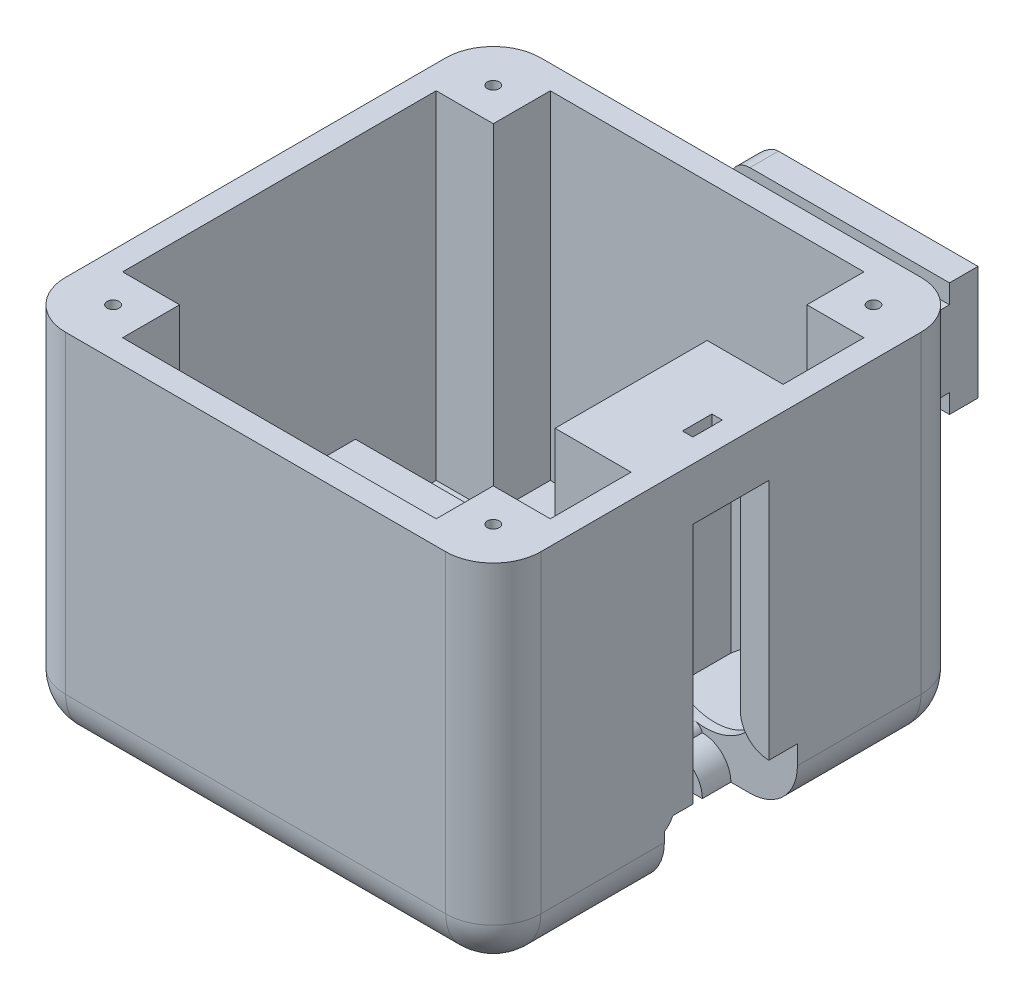
from build123d import *

# Parameters (mm, degrees)
SKETCH1_W                = 50
SKETCH1_H                = 50
BOSS_EXTRUDE1_DEPTH      = 38
SHELL1_T                 = -2.5
SKETCH3_W                = 45
SKETCH3_H                = 16
BOSS_EXTRUDE3_DEPTH      = 8
SKETCH4_W                = 32.5
SKETCH4_H                = 8
CUT_EXTRUDE1_DEPTH       = 3
SKETCH7_W                = 32.5
SKETCH7_H                = 12
CUT_EXTRUDE2_DEPTH       = 3
SKETCH8_W                = 16
SKETCH8_H                = 27.5
BOSS_EXTRUDE4_DEPTH      = 8
SKETCH9_W                = 8
SKETCH9_H                = 32.5
CUT_EXTRUDE3_DEPTH       = 3
CUT_EXTRUDE5_DEPTH       = 3
CUT_EXTRUDE7_DEPTH       = 10
CUT_EXTRUDE7_DEPTH_BACK  = 2
SKETCH13_W               = 3
SKETCH13_H               = 3.011524732
FILLET1_R                = 5
SKETCH16_R               = 2.3
CUT_EXTRUDE8_DEPTH       = 53.642663306
SKETCH17_W               = 23
SKETCH17_H               = 12
BOSS_EXTRUDE5_DEPTH      = 6
SKETCH18_W               = 3
SKETCH18_H               = 2
CUT_EXTRUDE9_DEPTH       = 57.471231614
CUT_EXTRUDE12_DEPTH      = 2
CUT_EXTRUDE13_DEPTH      = 2
CUT_EXTRUDE14_DEPTH      = 16
CUT_EXTRUDE10_START      = -19.5
CUT_EXTRUDE10_DEPTH      = 19.5
FILLET4_R                = 2
CUT_EXTRUDE18_DEPTH      = 13
CUT_EXTRUDE18_DEPTH_BACK = 1
SKETCH26_W               = 6
SKETCH26_H               = 6
BOSS_EXTRUDE6_DEPTH      = 4.5
SKETCH30_W               = 4.34
SKETCH30_H               = 1.8
CUT_EXTRUDE19_DEPTH      = 4.4
SKETCH31_W               = 1.8
SKETCH31_H               = 4.34
CUT_EXTRUDE20_DEPTH      = 4.4
SKETCH32_W               = 1.1
SKETCH32_H               = 3.1
CUT_EXTRUDE21_DEPTH      = 55.291896265
SKETCH33_W               = 3.1
SKETCH33_H               = 1.1
CUT_EXTRUDE22_DEPTH      = 3.55
SKETCH34_W               = 1.1
SKETCH34_H               = 3.1
CUT_EXTRUDE23_DEPTH      = 7.3
CUT_EXTRUDE26_DEPTH      = 2
SKETCH45_R               = 3.575
CUT_EXTRUDE27_DEPTH      = 20
FILLET8_R                = 2
SKETCH46_W               = 1.850257739
SKETCH46_H               = 4
SKETCH46_W_2             = 4
SKETCH46_H_2             = 1.850257739
CUT_EXTRUDE28_DEPTH      = 1
CUT_EXTRUDE25_START      = -3
CUT_EXTRUDE25_DEPTH      = 3
CUT_EXTRUDE24_START      = -3
CUT_EXTRUDE24_DEPTH      = 3
FILLET9_R                = 1
FILLET10_R               = 1
SKETCH47_W               = 6
SKETCH47_H               = 6
BOSS_EXTRUDE7_DEPTH      = 35.5
M1_6_TAPPED_HOLE1_D      = 1.25
M1_6_TAPPED_HOLE1_DEPTH  = 5
M1_6_TAPPED_HOLE1_TIP    = 0.375537887


with BuildPart() as part:
    # Sketch1 → Boss-Extrude1 (new body)
    with BuildSketch(Plane(origin=(0, 0, 0), x_dir=(1, 0, 0), z_dir=(0, 1, 0))):
        Rectangle(SKETCH1_W, SKETCH1_H)
    extrude(amount=BOSS_EXTRUDE1_DEPTH)

    # Shell1
    shell1_openings = [part.faces().sort_by_distance(p)[0] for p in [
        (0, 38, 0),
    ]]
    offset(amount=SHELL1_T, openings=shell1_openings, kind=Kind.INTERSECTION)

    # Sketch3 → Boss-Extrude3 (add)
    with BuildSketch(Plane(origin=(0, 2.5, 0), x_dir=(1, 0, 0), z_dir=(0, 1, 0))):
        Rectangle(SKETCH3_W, SKETCH3_H)
    extrude(amount=BOSS_EXTRUDE3_DEPTH)

    # Sketch4 → Cut-Extrude1 (cut)
    with BuildSketch(Plane.XZ):
        with Locations((8.75, 0)):
            Rectangle(SKETCH4_W, SKETCH4_H)
    extrude(amount=-CUT_EXTRUDE1_DEPTH, mode=Mode.SUBTRACT)

    # Sketch7 → Cut-Extrude2 (cut)
    with BuildSketch(Plane(origin=(0, 3, 0), x_dir=(-1, 0, 0), z_dir=(0, -1, 0))):
        with Locations((-8.75, 0)):
            Rectangle(SKETCH7_W, SKETCH7_H)
    extrude(amount=-CUT_EXTRUDE2_DEPTH, mode=Mode.SUBTRACT)

    # Sketch8 → Boss-Extrude4 (add)
    with BuildSketch(Plane.ZY.offset(-22.5)):
        with Locations((0, 24.25)):
            Rectangle(SKETCH8_W, SKETCH8_H)
    extrude(amount=BOSS_EXTRUDE4_DEPTH)

    # Sketch9 → Cut-Extrude3 (cut)
    with BuildSketch(Plane(origin=(25, 0, 0), x_dir=(0, 0, -1), z_dir=(1, 0, 0))):
        with Locations((0, 16.25)):
            Rectangle(SKETCH9_W, SKETCH9_H)
    extrude(amount=-CUT_EXTRUDE3_DEPTH, mode=Mode.SUBTRACT)

    # Sketch10 → Cut-Extrude5 (cut)
    with BuildSketch(Plane(origin=(22, 0, 0), x_dir=(0, 0, -1), z_dir=(1, 0, 0))):
        Polygon((-6, 32.5), (-6, 0), (6, 0), (6, 3), (6, 32.5), align=None)
    extrude(amount=-CUT_EXTRUDE5_DEPTH, mode=Mode.SUBTRACT)

    # Sketch13 → Cut-Extrude7 (cut, two sides: drawn at the far end of the back side and taken through both)
    with BuildSketch(Plane(origin=(0, 0, 4), x_dir=(-1, 0, 0), z_dir=(0, 0, -1)).offset(-CUT_EXTRUDE7_DEPTH_BACK)):
        with Locations((-23.5, 1.505762366)):
            Rectangle(SKETCH13_W, SKETCH13_H)
    extrude(amount=CUT_EXTRUDE7_DEPTH + CUT_EXTRUDE7_DEPTH_BACK, mode=Mode.SUBTRACT)

    # Fillet1
    fillet1_edges = [part.edges().sort_by_distance(p)[0] for p in [
        (25, 0, -15.5),
        (0, 0, -25),
        (25, 0, 15.5),
        (0, 0, 25),
        (-25, 0, 0),
        (-25, 19, -25),
        (25, 19, -25),
        (25, 19, 25),
        (-25, 19, 25),
    ]]
    fillet(fillet1_edges, radius=FILLET1_R)

    # Sketch16 → Cut-Extrude8 (cut, through all)
    with BuildSketch(Plane(origin=(0, 0, 1.5), x_dir=(-1, 0, 0), z_dir=(0, 0, -1))):
        with Locations(Location((-15.3, 9.7, 0), (0, 0, 180))):
            Circle(SKETCH16_R)
    extrude(amount=CUT_EXTRUDE8_DEPTH, mode=Mode.SUBTRACT)

    # Sketch17 → Boss-Extrude5 (add)
    with BuildSketch(Plane(origin=(0, 0, -25), x_dir=(-1, 0, 0), z_dir=(0, 0, -1))):
        with Locations((-8.5, 30)):
            Rectangle(SKETCH17_W, SKETCH17_H)
    extrude(amount=BOSS_EXTRUDE5_DEPTH)

    # Sketch18 → Cut-Extrude9 (cut, through all)
    with BuildSketch(Plane.ZY.offset(3)):
        with Locations((-26.5, 25)):
            Rectangle(SKETCH18_W, SKETCH18_H)
        with Locations((-26.5, 35)):
            Rectangle(SKETCH18_W, SKETCH18_H)
    extrude(amount=-CUT_EXTRUDE9_DEPTH, mode=Mode.SUBTRACT)

    # Sketch20 → Cut-Extrude12 (cut)
    with BuildSketch(Plane(origin=(0, 0, 4), x_dir=(-1, 0, 0), z_dir=(0, 0, -1))):
        with BuildLine():
            Line((-22, 10), (-22, 7))
            Line((-22, 7), (-22, 6))
            Line((-22, 6), (-24, 6))
            Line((-24, 6), (-25, 6))
            Line((-25, 6), (-25, 7))
            ThreePointArc((-25, 7), (-22.878679656, 7.878679656), (-22, 10))
        make_face()
    extrude(amount=-CUT_EXTRUDE12_DEPTH, mode=Mode.SUBTRACT)

    # Sketch21 → Cut-Extrude13 (cut)
    with BuildSketch(Plane(origin=(0, 0, 4), x_dir=(-1, 0, 0), z_dir=(0, 0, -1))):
        with BuildLine():
            Line((-19, 3), (-19, 0))
            Line((-19, 0), (-18, 0))
            ThreePointArc((-18, 0), (-17.121320344, 2.121320344), (-15, 3))
            Line((-15, 3), (-19, 3))
        make_face()
    extrude(amount=-CUT_EXTRUDE13_DEPTH, mode=Mode.SUBTRACT)

    # Sketch22 → Cut-Extrude14 (cut)
    with BuildSketch(Plane(origin=(0, 0, 4), x_dir=(-1, 0, 0), z_dir=(0, 0, -1))):
        with BuildLine():
            Line((-15.3, 9.7), (-11.411555581, 5))
            ThreePointArc((-11.411555581, 5), (-19.613351365, 5.386648635), (-20, 13.588444419))
            Line((-20, 13.588444419), (-15.3, 9.7))
        make_face()
    extrude(amount=CUT_EXTRUDE14_DEPTH, mode=Mode.SUBTRACT)

    # Sketch19 → Cut-Extrude10 (cut)
    with BuildSketch(Plane(origin=(0, 0, -25), x_dir=(-1, 0, 0), z_dir=(0, 0, -1)).offset(CUT_EXTRUDE10_START)):
        with BuildLine():
            ThreePointArc((-16.49025244, 7.731930101), (-16.926345597, 8.073654403), (-17.268069899, 8.50974756))
            Line((-17.268069899, 8.50974756), (-17.798399985, 7.979417474))
            Line((-17.798399985, 7.979417474), (-17.020582526, 7.201600015))
            Line((-17.020582526, 7.201600015), (-16.49025244, 7.731930101))
        make_face()
        with BuildLine():
            ThreePointArc((-14.10974756, 11.668069899), (-13.673654403, 11.326345597), (-13.331930101, 10.89025244))
            Line((-13.331930101, 10.89025244), (-12.801600015, 11.420582526))
            Line((-12.801600015, 11.420582526), (-13.579417474, 12.198399985))
            Line((-13.579417474, 12.198399985), (-14.10974756, 11.668069899))
        make_face()
    extrude(amount=CUT_EXTRUDE10_DEPTH, mode=Mode.SUBTRACT)

    # Fillet4
    fillet4_edges = [part.edges().sort_by_distance(p)[0] for p in [
        (-3, 36, -29.5),
        (-3, 24, -29.5),
        (-3, 30, -31),
    ]]
    fillet(fillet4_edges, radius=FILLET4_R)

    # Sketch26 → Cut-Extrude18 (cut, two sides: drawn at the far end of the back side and taken through both)
    with BuildSketch(Plane(origin=(0, 0, 6), x_dir=(-1, 0, 0), z_dir=(0, 0, -1)).offset(-CUT_EXTRUDE18_DEPTH_BACK)):
        with Locations((-22, 3)):
            Rectangle(SKETCH26_W, SKETCH26_H)
    extrude(amount=CUT_EXTRUDE18_DEPTH + CUT_EXTRUDE18_DEPTH_BACK, mode=Mode.SUBTRACT)

    # Sketch29 → Boss-Extrude6 (add)
    with BuildSketch(Plane(origin=(0, 0, 6), x_dir=(-1, 0, 0), z_dir=(0, 0, -1))):
        with BuildLine():
            Line((-16.487340596, 10.682320832), (-15.313754074, 9.647314806))
            Line((-15.313754074, 9.647314806), (-14.282640056, 8.470307295))
            ThreePointArc((-14.282640056, 8.470307295), (-14.205455569, 10.751949236), (-16.487340596, 10.682320832))
        make_face()
    extrude(amount=BOSS_EXTRUDE6_DEPTH)

    # Sketch30 → Cut-Extrude19 (cut)
    with BuildSketch(Plane(origin=(-7.5, 0, 0), x_dir=(0, 0, -1), z_dir=(1, 0, 0))):
        with Locations((0, 3)):
            Rectangle(SKETCH30_W, SKETCH30_H)
    extrude(amount=-CUT_EXTRUDE19_DEPTH, mode=Mode.SUBTRACT)

    # Sketch31 → Cut-Extrude20 (cut)
    with BuildSketch(Plane.XZ.offset(-32.5)):
        with Locations((22, 0)):
            Rectangle(SKETCH31_W, SKETCH31_H)
    extrude(amount=-CUT_EXTRUDE20_DEPTH, mode=Mode.SUBTRACT)

    # Sketch32 → Cut-Extrude21 (cut, through all)
    with BuildSketch(Plane.XZ.offset(-36.9)):
        with Locations((22, 0)):
            Rectangle(SKETCH32_W, SKETCH32_H)
    extrude(amount=-CUT_EXTRUDE21_DEPTH, mode=Mode.SUBTRACT)

    # Sketch33 → Cut-Extrude22 (cut)
    with BuildSketch(Plane(origin=(-11.9, 0, 0), x_dir=(0, 0, -1), z_dir=(1, 0, 0))):
        with Locations((0, 3)):
            Rectangle(SKETCH33_W, SKETCH33_H)
    extrude(amount=-CUT_EXTRUDE22_DEPTH, mode=Mode.SUBTRACT)

    # Sketch34 → Cut-Extrude23 (cut)
    with BuildSketch(Plane(origin=(0, 10.5, 0), x_dir=(1, 0, 0), z_dir=(0, 1, 0))):
        with Locations((-13.4, 0)):
            Rectangle(SKETCH34_W, SKETCH34_H)
    extrude(amount=-CUT_EXTRUDE23_DEPTH, mode=Mode.SUBTRACT)

    # Sketch44 → Cut-Extrude26 (cut)
    with BuildSketch(Plane(origin=(0, 0, 4), x_dir=(-1, 0, 0), z_dir=(0, 0, -1))):
        Polygon((-19, 12.761115819), (-19, 6), (-12.238884181, 6), (-14.282640056, 8.470307295), (-15.313754074, 9.647314806), (-16.487340596, 10.682320832), align=None)
    extrude(amount=-CUT_EXTRUDE26_DEPTH, mode=Mode.SUBTRACT)

    # Sketch45 → Cut-Extrude27 (cut)
    with BuildSketch(Plane(origin=(0, 0, 1.5), x_dir=(-1, 0, 0), z_dir=(0, 0, -1))):
        with Locations((-15.3, 9.7)):
            Circle(SKETCH45_R)
    extrude(amount=CUT_EXTRUDE27_DEPTH, mode=Mode.SUBTRACT)

    # Fillet8
    # the kernel refuses this fillet: 2 mm, written as the material it takes off along each edge
    with BuildSketch(Plane(origin=(19, 6, 6), x_dir=(-1, 0, 0), z_dir=(0, -1, 0))) as fillet8_piece_1_section:
        with BuildLine():
            CenterArc((1.732050808, -2), FILLET8_R, 90, 60)
            Line((0, -1), (0, 0))
            Line((0, 0), (1.732050808, 0))
        make_face()
    fillet8_piece_1 = extrude(amount=10.330127019, mode=Mode.PRIVATE)
    fillet8_piece_1 = fillet8_piece_1 - Plane(origin=(15, 0, 6), x_dir=(1, 0, 0), z_dir=(0, 0, -1)) * Cylinder(3, 28, mode=Mode.PRIVATE)
    add(fillet8_piece_1, mode=Mode.SUBTRACT)
    with BuildSketch(Plane(origin=(29.330127019, 6, 6), x_dir=(0, 1, 0), z_dir=(-1, 0, 0))) as fillet8_piece_2_section:
        with BuildLine():
            CenterArc((1.732050808, -2), FILLET8_R, 90, 60)
            Line((0, -1), (0, 0))
            Line((0, 0), (1.732050808, 0))
        make_face()
    fillet8_piece_2 = extrude(amount=10.330127019, mode=Mode.PRIVATE)
    fillet8_piece_2 = fillet8_piece_2 - Plane(origin=(25, 10, 6), x_dir=(0, -1, 0), z_dir=(0, 0, -1)) * Cylinder(3, 28, mode=Mode.PRIVATE)
    add(fillet8_piece_2, mode=Mode.SUBTRACT)
    with BuildSketch(Plane(origin=(25, 6, 6), x_dir=(0, 1, 0), z_dir=(-1, 0, 0))) as fillet8_piece_3a_section:
        with BuildLine():
            CenterArc((1.732050808, -2), FILLET8_R, 90, 60)
            Line((0, -1), (0, 0))
            Line((0, 0), (1.732050808, 0))
        make_face()
    fillet8_piece_3a = extrude(amount=10.330127019, mode=Mode.PRIVATE)
    fillet8_piece_3a = split(fillet8_piece_3a, bisect_by=Plane(origin=(19, 6, 6), z_dir=(-1, 0, 0)), keep=Keep.TOP, mode=Mode.PRIVATE)
    with BuildSketch(Plane(origin=(19, 10.330127019, 6), x_dir=(-1, 0, 0), z_dir=(0, -1, 0))) as fillet8_piece_3b_section:
        with BuildLine():
            CenterArc((1.732050808, -2), FILLET8_R, 90, 60)
            Line((0, -1), (0, 0))
            Line((0, 0), (1.732050808, 0))
        make_face()
    fillet8_piece_3b = extrude(amount=10.330127019, mode=Mode.PRIVATE)
    fillet8_piece_3b = split(fillet8_piece_3b, bisect_by=Plane(origin=(19, 6, 6), z_dir=(0, 1, 0)), keep=Keep.TOP, mode=Mode.PRIVATE)
    fillet8_piece_3 = fillet8_piece_3a & fillet8_piece_3b
    add(fillet8_piece_3, mode=Mode.SUBTRACT)

    # Sketch46 → Cut-Extrude28 (cut)
    with BuildSketch(Plane.XY.offset(-6)):
        with Locations((21.074871131, 8)):
            Rectangle(SKETCH46_W, SKETCH46_H)
        with Locations((17, 3.925128869)):
            Rectangle(SKETCH46_W_2, SKETCH46_H_2)
    extrude(amount=-CUT_EXTRUDE28_DEPTH, mode=Mode.SUBTRACT)

    # Sketch43 → Cut-Extrude25 (cut)
    with BuildSketch(Plane.XY.offset(-4).offset(CUT_EXTRUDE25_START)):
        with BuildLine():
            Line((19, 0), (18, 0))
            ThreePointArc((18, 0), (17.121320344, 2.121320344), (15, 3))
            Line((15, 3), (19, 3))
            Line((19, 3), (19, 0))
        make_face()
    extrude(amount=CUT_EXTRUDE25_DEPTH, mode=Mode.SUBTRACT)

    # Sketch42 → Cut-Extrude24 (cut)
    with BuildSketch(Plane.XY.offset(-4).offset(CUT_EXTRUDE24_START)):
        with BuildLine():
            Line((22, 6), (25, 6))
            Line((25, 6), (25, 7))
            ThreePointArc((25, 7), (22.878679656, 7.878679656), (22, 10))
            Line((22, 10), (22, 6))
        make_face()
    extrude(amount=CUT_EXTRUDE24_DEPTH, mode=Mode.SUBTRACT)

    # Fillet9
    # the kernel refuses this fillet: 1 mm, written as the material it takes off along each edge
    with BuildSketch(Plane(origin=(21.392618485, 10, -7), x_dir=(1, 0, 0), z_dir=(0, 0, 1))) as fillet9_piece_1:
        with BuildLine():
            CenterArc((0.89509571, 0.957716316), FILLET9_R, 190.203399986, 63.075442435)
            Line((-0.089089388, 0.780573173), (-0.10877309, 0.77703031))
            ThreePointArc((-0.10877309, 0.77703031), (-0.051836033, 0.389454402), (-0.019975798, -0.000983607))
            Line((-0.019975798, -0.000983607), (0, -0.02))
            ThreePointArc((0, -0.02), (0.303690758, -0.02), (0.601627231, -0.019154326))
            Line((0.601627231, -0.019154326), (0.607381515, 0))
        make_face()
    extrude(amount=2.96410189, mode=Mode.SUBTRACT)
    with BuildSketch(Plane(origin=(15, 3.607381515, -7), x_dir=(0, -1, 0), z_dir=(0, 0, 1))) as fillet9_piece_2:
        with BuildLine():
            CenterArc((0.89509571, -0.957716316), FILLET9_R, 106.721157579, 63.075442435)
            Line((-0.089089388, -0.780573173), (-0.10877309, -0.77703031))
            ThreePointArc((-0.10877309, -0.77703031), (-0.051836033, -0.389454402), (-0.019975798, 0.000983607))
            Line((-0.019975798, 0.000983607), (0, 0.02))
            ThreePointArc((0, 0.02), (0.303690758, 0.02), (0.601627231, 0.019154326))
            Line((0.601627231, 0.019154326), (0.607381515, 0))
        make_face()
    extrude(amount=2.96410189, mode=Mode.SUBTRACT)

    # Fillet10
    fillet10_edges = [part.edges().sort_by_distance(p)[0] for p in [
        (11.815660034, 10.5, -3.25),
        (14.5, 13.184339966, -3.25),
    ]]
    fillet(fillet10_edges, radius=FILLET10_R)

    # Sketch47 → Boss-Extrude7 (add)
    with BuildSketch(Plane(origin=(0, 2.5, 0), x_dir=(1, 0, 0), z_dir=(0, 1, 0))):
        with Locations((19.5, 19.5)):
            Rectangle(SKETCH47_W, SKETCH47_H)
        with Locations((-19.5, 19.5)):
            Rectangle(SKETCH47_W, SKETCH47_H)
        with Locations((19.5, -19.5)):
            Rectangle(SKETCH47_W, SKETCH47_H)
        with Locations((-19.5, -19.5)):
            Rectangle(SKETCH47_W, SKETCH47_H)
    extrude(amount=BOSS_EXTRUDE7_DEPTH)

    # M1.6 Tapped Hole1
    with Locations(Plane(origin=(0, 38, 0), x_dir=(1, 0, 0), z_dir=(0, 1, 0))):
        with Locations((-20, -20), (-20, 20), (20, 20), (20, -20)):
            Hole(M1_6_TAPPED_HOLE1_D / 2, depth=M1_6_TAPPED_HOLE1_DEPTH)
            with Locations((0, 0, -(M1_6_TAPPED_HOLE1_DEPTH + M1_6_TAPPED_HOLE1_TIP / 2))):  # 118° drill point
                Cone(0, M1_6_TAPPED_HOLE1_D / 2, M1_6_TAPPED_HOLE1_TIP, mode=Mode.SUBTRACT)


solid = part.part
